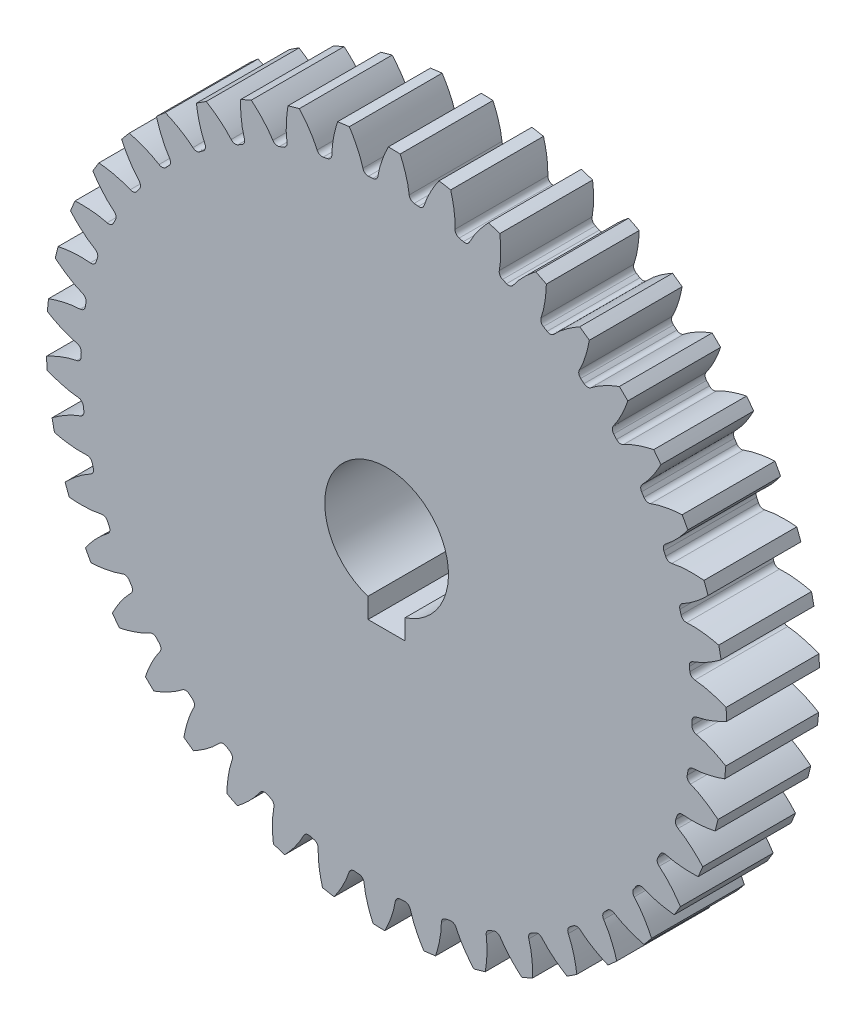
from build123d import *

# Parameters (mm, degrees)
SKETCH_1_R                       = 55
EXTRUDE_1_DEPTH                  = 7.5
CUT_EXTRUDE_START                = -7.5
CUT_EXTRUDE_1_DEPTH              = 15
FILLET_1_R                       = 0.875
PATTERN_CIRCULAR_1_COUNT         = 42
FILLET_1_OF_PATTERN_CIRCULAR_1_R = 0.875
CUT_EXTRUDE_2_DEPTH              = 79.118368238
CUT_EXTRUDE_2_DEPTH_BACK         = 79.118368238
SKETCH_5_R                       = 10
SKETCH_5_W                       = 6
SKETCH_5_H                       = 12.8


# Read off the part's stored shape, not the designer's step: 切除-拉伸1
with BuildPart() as part:
    # 草图1 → 凸台-拉伸1 (new, symmetric)
    with BuildSketch(Plane.XY):
        Circle(SKETCH_1_R)
    extrude(amount=EXTRUDE_1_DEPTH, both=True)

    # 切除-拉伸1 outline → 切除-拉伸1 (cut)
    with BuildSketch(Plane.XY.offset(CUT_EXTRUDE_START)):
        with BuildLine():
            add(Edge.make_bspline(
                [(49.374999984, 0.001257602), (49.401162174, 0.002293118), (49.493050449, 0.007267746), (49.675566787, 0.024749187), (49.97870943, 0.066139257), (50.375516716, 0.140157117), (50.884664233, 0.258147521), (51.657440737, 0.475901128), (52.475206079, 0.761712542), (53.333235455, 1.114942636), (54.123964896, 1.485487846), (54.571853425, 1.711851064), (54.851451181, 1.859440588), (54.966435358, 1.921193379)],
                knots=[0.001516736, 0.001516736, 0.001516736, 0.001516736, 0.001516736, 0.005376748, 0.015083688, 0.02853182, 0.046610139, 0.064854849, 0.092110525, 0.146842495, 0.174208853, 0.201574955, 0.220815482, 0.220815482, 0.220815482, 0.220815482, 0.220815482], degree=4))
            ThreePointArc((49.374999984, 0.001257602), (49.362507403, -1.110624991), (49.324979357, -2.221944301))
            add(Edge.make_bspline(
                [(49.324979357, -2.221944301), (49.351068512, -2.22415544), (49.442640098, -2.233257801), (49.624185562, -2.258930411), (49.925159992, -2.313912755), (50.318236843, -2.405702546), (50.821562573, -2.546473017), (51.583763651, -2.798762758), (52.387847084, -3.121064887), (53.229121592, -3.512528419), (54.002385025, -3.918262437), (54.439639112, -4.164540662), (54.712315603, -4.324555817), (54.824405635, -4.391417404)],
                knots=[0.001516736, 0.001516736, 0.001516736, 0.001516736, 0.001516736, 0.005376748, 0.015083688, 0.02853182, 0.046610139, 0.064854849, 0.092110525, 0.146842495, 0.174208853, 0.201574955, 0.220815407, 0.220815407, 0.220815407, 0.220815407, 0.220815407], degree=4))
            ThreePointArc((54.824405635, -4.391417404), (54.986084196, -1.237151888), (54.966435358, 1.921193379))
        make_face()
    cut_extrude_1 = extrude(amount=CUT_EXTRUDE_1_DEPTH, mode=Mode.SUBTRACT)

    # 圆角1
    fillet_1_edges = [part.edges().sort_by_distance(p)[0] for p in [
        (49.324979357, -2.221944301, 0),
        (49.374999984, 0.001257602, 0),
    ]]
    fillet(fillet_1_edges, radius=FILLET_1_R)

    # 阵列(圆周)1: 切除-拉伸1 ×42 about axis
    pattern_circular_1_axis = Axis((0, 0, 7.5), (0, 0, -1))
    for i in range(1, PATTERN_CIRCULAR_1_COUNT):
        add(cut_extrude_1.rotate(pattern_circular_1_axis, i * 360 / PATTERN_CIRCULAR_1_COUNT), mode=Mode.SUBTRACT)

    # 圆角1 of 阵列(圆周)1
    fillet_1_of_pattern_circular_1_edges = [part.edges().sort_by_distance(p)[0] for p in [
        (48.442896477, -9.548633721, 0),
        (48.823709465, -7.357718334, 0),
        (46.47867934, -16.662022443, 0),
        (47.181777955, -14.552335002, 0),
        (43.476205309, -23.403209117, 0),
        (44.485883491, -21.421876552, 0),
        (39.502544694, -29.621606771, 0),
        (40.796247901, -27.812888778, 0),
        (34.646462507, -35.178306679, 0),
        (36.195291546, -33.582607029, 0),
        (29.016435599, -39.949181345, 0),
        (30.78579219, -38.602145332, 0),
        (22.738229468, -43.827657315, 0),
        (24.688589107, -42.759375497, 0),
        (15.952088864, -46.727095843, 0),
        (18.039883741, -45.961431871, 0),
        (8.809604956, -48.582728264, 0),
        (10.988197182, -48.136785806, 0),
        (1.470329029, -49.353102816, 0),
        (3.691052455, -49.236843489, 0),
        (-5.901791618, -49.021010605, 0),
        (-3.688544284, -49.237031451, 0),
        (-13.142075992, -47.593870022, 0),
        (-10.985745039, -48.137345491, 0),
        (-20.088788106, -45.103561029, 0),
        (-18.037542404, -45.962350778, 0),
        (-26.586749889, -41.605713014, 0),
        (-24.686410877, -42.760633099, 0),
        (-32.490807613, -37.178462121, 0),
        (-30.783825724, -38.603713536, 0),
        (-37.669074384, -31.920705821, 0),
        (-36.193580773, -33.584450804, 0),
        (-42.00587628, -25.9498937, 0),
        (-40.794831036, -27.814966937, 0),
        (-45.404336312, -19.399403834, 0),
        (-44.484792185, -21.424142672, 0),
        (-47.788538499, -12.415563343, 0),
        (-47.181036586, -14.554738462, 0),
        (-49.105223705, -5.154379683, 0),
        (-48.823334593, -7.360205446, 0),
        (-49.324979357, 2.221944301, 0),
        (-49.374999984, -0.001257602, 0),
        (-48.442896477, 9.548633721, 0),
        (-48.823709465, 7.357718334, 0),
        (-46.47867934, 16.662022443, 0),
        (-47.181777955, 14.552335002, 0),
        (-43.476205309, 23.403209117, 0),
        (-44.485883491, 21.421876552, 0),
        (-39.502544694, 29.621606771, 0),
        (-40.796247901, 27.812888778, 0),
        (-34.646462507, 35.178306679, 0),
        (-36.195291546, 33.582607029, 0),
        (-29.016435599, 39.949181345, 0),
        (-30.78579219, 38.602145332, 0),
        (-22.738229468, 43.827657315, 0),
        (-24.688589107, 42.759375497, 0),
        (-15.952088864, 46.727095843, 0),
        (-18.039883741, 45.961431871, 0),
        (-8.809604956, 48.582728264, 0),
        (-10.988197182, 48.136785806, 0),
        (-1.470329029, 49.353102816, 0),
        (-3.691052455, 49.236843489, 0),
        (5.901791618, 49.021010605, 0),
        (3.688544284, 49.237031451, 0),
        (13.142075992, 47.593870022, 0),
        (10.985745039, 48.137345491, 0),
        (20.088788106, 45.103561029, 0),
        (18.037542404, 45.962350778, 0),
        (26.586749889, 41.605713014, 0),
        (24.686410877, 42.760633099, 0),
        (32.490807613, 37.178462121, 0),
        (30.783825724, 38.603713536, 0),
        (37.669074384, 31.920705821, 0),
        (36.193580773, 33.584450804, 0),
        (42.00587628, 25.9498937, 0),
        (40.794831036, 27.814966937, 0),
        (45.404336312, 19.399403834, 0),
        (44.484792185, 21.424142672, 0),
        (47.788538499, 12.415563343, 0),
        (47.181036586, 14.554738462, 0),
        (49.105223705, 5.154379683, 0),
        (48.823334593, 7.360205446, 0),
    ]]
    fillet(fillet_1_of_pattern_circular_1_edges, radius=FILLET_1_OF_PATTERN_CIRCULAR_1_R)

    # 草图5 → 切除-拉伸2 (cut, two sides: drawn at the far end of the back side and taken through both)
    with BuildSketch(Plane.XY.offset(-CUT_EXTRUDE_2_DEPTH_BACK)):
        Circle(SKETCH_5_R)
        with Locations((0, -6.4)):
            Rectangle(SKETCH_5_W, SKETCH_5_H)
    extrude(amount=CUT_EXTRUDE_2_DEPTH + CUT_EXTRUDE_2_DEPTH_BACK, mode=Mode.SUBTRACT)


solid = part.part
